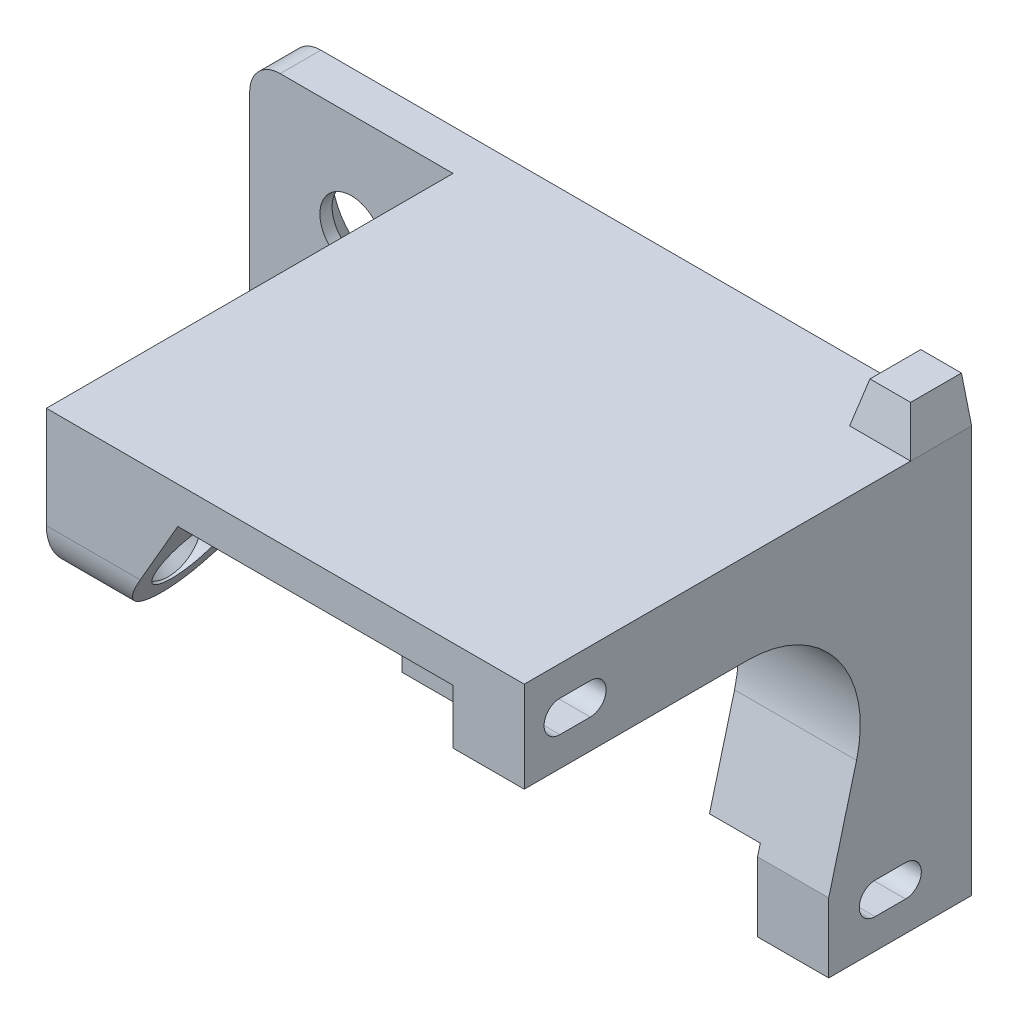
from build123d import *
from OCP.BRepFilletAPI import BRepFilletAPI_MakeChamfer

# Parameters (mm, degrees)
SKETCH1_R           = 3.1
BOSS_EXTRUDE1_DEPTH = 9
SKETCH2_W           = 20
SKETCH2_H           = 40
CUT_EXTRUDE1_DEPTH  = 5
SKETCH3_R           = 6.05
CUT_EXTRUDE2_DEPTH  = 5
BOSS_EXTRUDE2_DEPTH = 35
SKETCH5_W           = 7
SKETCH5_H           = 12
CUT_EXTRUDE3_DEPTH  = 6
CHAMFER1_SIZE       = 6
CHAMFER1_SIZE2      = 4
CHAMFER2_SIZE       = 1
CUT_EXTRUDE4_DEPTH  = 12
CUT_EXTRUDE5_START  = -7
CUT_EXTRUDE5_DEPTH  = 11
SKETCH8_W           = 6
SKETCH8_H           = 6
BOSS_EXTRUDE3_DEPTH = 4
CHAMFER5_SIZE       = 4
CHAMFER5_SIZE_2     = 1
CHAMFER6_SIZE       = 1
CHAMFER6_SIZE2      = 4
CHAMFER7_SIZE       = 2.8
BOSS_EXTRUDE4_DEPTH = 6
CHAMFER8_START      = 16
CHAMFER8_DEPTH      = 0.515103423
CHAMFER8_START_2    = 16.515103423
CHAMFER8_2_DEPTH    = 6.413099807
CHAMFER8_START_3    = 11.656406461
CHAMFER8_3_DEPTH    = 6.343593539
CUT_EXTRUDE6_REACH  = 70.71
SKETCH10_R          = 1.55
CUT_EXTRUDE7_REACH  = 77.71
CUT_EXTRUDE7_START  = -7
SKETCH11_R          = 3.35
CHAMFER9_SIZE       = 1.8


with BuildPart() as part:
    # Sketch1 → Boss-Extrude1 (new body)
    with BuildSketch(Plane.XY):
        with BuildLine():
            Line((-10, 17), (-10, -17))
            ThreePointArc((-10, -17), (-9.121320344, -19.121320344), (-7, -20))
            Line((-7, -20), (10, -20))
            Line((10, -20), (25, -20))
            Line((25, -20), (38, -2))
            Line((38, -2), (45, -2))
            Line((45, -2), (45, -20))
            Line((45, -20), (57, -20))
            Line((57, -20), (57, 20))
            Line((57, 20), (-7, 20))
            ThreePointArc((-7, 20), (-9.121320344, 19.121320344), (-10, 17))
        make_face()
        with Locations((0, 10)):
            Circle(SKETCH1_R, mode=Mode.SUBTRACT)
        with Locations((0, -10)):
            Circle(SKETCH1_R, mode=Mode.SUBTRACT)
    extrude(amount=BOSS_EXTRUDE1_DEPTH)

    # Sketch2 → Cut-Extrude1 (cut)
    with BuildSketch(Plane.XY.offset(9)):
        Rectangle(SKETCH2_W, SKETCH2_H)
    extrude(amount=-CUT_EXTRUDE1_DEPTH, mode=Mode.SUBTRACT)

    # Sketch3 → Cut-Extrude2 (cut)
    with BuildSketch(Plane.XY.offset(9)):
        with Locations((28, -8)):
            Circle(SKETCH3_R)
    extrude(amount=-CUT_EXTRUDE2_DEPTH, mode=Mode.SUBTRACT)

    # Sketch4 → Boss-Extrude2 (add)
    with BuildSketch(Plane.XY.offset(9)):
        Polygon((45, -20), (57, -20), (57, 20), (10, 20), (10, 16.4), (45, 16.4), align=None)
    extrude(amount=BOSS_EXTRUDE2_DEPTH)

    # Sketch5 → Cut-Extrude3 (cut)
    with BuildSketch(Plane.XY.offset(9)):
        with Locations((41.5, 4)):
            Rectangle(SKETCH5_W, SKETCH5_H)
    extrude(amount=-CUT_EXTRUDE3_DEPTH, mode=Mode.SUBTRACT)

    # Chamfer1
    chamfer1_edges = [part.edges().sort_by_distance(p)[0] for p in [
        (41.5, 10, 9),
    ]]
    chamfer1_side = [part.faces().sort_by_distance(p)[0] for p in [
        (23.115817962, 1.462286031, 9),
    ]]
    chamfer(chamfer1_edges, length=CHAMFER1_SIZE, length2=CHAMFER1_SIZE2, reference=chamfer1_side[0])

    # Chamfer2
    chamfer2_edges = [part.edges().sort_by_distance(p)[0] for p in [
        (41.5, -2, 3),
    ]]
    chamfer(chamfer2_edges, length=CHAMFER2_SIZE)

    # Sketch6 → Cut-Extrude4 (cut)
    with BuildSketch(Plane(origin=(57, 0, 0), x_dir=(0, 0, -1), z_dir=(1, 0, 0))):
        with BuildLine():
            Line((-22, 11.05), (-44, 11.05))
            Line((-44, 11.05), (-44, -20))
            Line((-44, -20), (-14.055648488, -20))
            Line((-14.055648488, -20), (-14.055648488, -13.173106135))
            Line((-14.055648488, -13.173106135), (-11.317710156, -2.826868177))
            ThreePointArc((-11.317710156, -2.826868177), (-13.243876618, 6.740385992), (-22, 11.05))
        make_face()
        with BuildLine():
            Line((-40.5, 17.05), (-37.5, 17.05))
            ThreePointArc((-37.5, 17.05), (-35.95, 15.5), (-37.5, 13.95))
            Line((-37.5, 13.95), (-40.5, 13.95))
            ThreePointArc((-40.5, 13.95), (-42.05, 15.5), (-40.5, 17.05))
        make_face()
        with BuildLine():
            Line((-9.5, -17.05), (-6.5, -17.05))
            ThreePointArc((-6.5, -17.05), (-4.95, -15.5), (-6.5, -13.95))
            Line((-6.5, -13.95), (-9.5, -13.95))
            ThreePointArc((-9.5, -13.95), (-11.05, -15.5), (-9.5, -17.05))
        make_face()
    extrude(amount=-CUT_EXTRUDE4_DEPTH, mode=Mode.SUBTRACT)

    # Sketch7 → Cut-Extrude5 (cut)
    with BuildSketch(Plane(origin=(57, 0, 0), x_dir=(0, 0, -1), z_dir=(1, 0, 0)).offset(CUT_EXTRUDE5_START)):
        with BuildLine():
            Line((-6.5, -18.85), (-6.5, -20))
            Line((-6.5, -20), (-14.055648488, -20))
            Line((-14.055648488, -20), (-14.055648488, -12.15))
            Line((-14.055648488, -12.15), (-6.5, -12.15))
            ThreePointArc((-6.5, -12.15), (-3.15, -15.5), (-6.5, -18.85))
        make_face()
        with BuildLine():
            Line((-37.5, 18.85), (-40.5, 18.85))
            ThreePointArc((-40.5, 18.85), (-42.009108789, 18.490834443), (-43.194623608, 17.490352635))
            Line((-43.194623608, 17.490352635), (-44, 16.4))
            Line((-44, 16.4), (-44, 11.05))
            Line((-44, 11.05), (-37.5, 11.05))
            Line((-37.5, 11.05), (-37.5, 12.15))
            ThreePointArc((-37.5, 12.15), (-34.15, 15.5), (-37.5, 18.85))
        make_face()
    extrude(amount=-CUT_EXTRUDE5_DEPTH, mode=Mode.SUBTRACT)

    # Sketch8 → Boss-Extrude3 (add)
    with BuildSketch(Plane(origin=(0, 20, 0), x_dir=(1, 0, 0), z_dir=(0, 1, 0))):
        with Locations((54, -3)):
            Rectangle(SKETCH8_W, SKETCH8_H)
    extrude(amount=BOSS_EXTRUDE3_DEPTH)

    # Chamfer5
    chamfer5_edges_1 = [part.edges().sort_by_distance(p)[0] for p in [
        (51, 24, 3),
    ]]
    chamfer5_side_1 = [part.faces().sort_by_distance(p)[0] for p in [
        (51, 23.98, 3),
    ]]
    chamfer5_edges_2 = [part.edges().sort_by_distance(p)[0] for p in [
        (54, 24, 6),
    ]]
    chamfer5_side_2 = [part.faces().sort_by_distance(p)[0] for p in [
        (54, 24, 5.98),
    ]]
    chamfer5_edges_3 = [part.edges().sort_by_distance(p)[0] for p in [
        (57, 24, 3),
    ]]
    chamfer5_side_3 = [part.faces().sort_by_distance(p)[0] for p in [
        (56.98, 24, 3),
    ]]
    chamfer5 = BRepFilletAPI_MakeChamfer(part.part.solid().wrapped)
    for e in chamfer5_edges_1:
        chamfer5.Add(CHAMFER5_SIZE - 0.0001, CHAMFER5_SIZE_2 - 0.0001, e.wrapped, chamfer5_side_1[0].wrapped)
    for e in chamfer5_edges_2:
        chamfer5.Add(CHAMFER5_SIZE_2 - 0.0001, CHAMFER5_SIZE - 0.0001, e.wrapped, chamfer5_side_2[0].wrapped)
    for e in chamfer5_edges_3:
        chamfer5.Add(CHAMFER5_SIZE_2 - 0.0001, CHAMFER5_SIZE - 0.0001, e.wrapped, chamfer5_side_3[0].wrapped)
    add(Compound.cast(chamfer5.Shape()), mode=Mode.REPLACE)  # a hair under: the kernel refuses the full size

    # Chamfer6
    chamfer6_edges = [part.edges().sort_by_distance(p)[0] for p in [
        (38, 7, 9),
    ]]
    chamfer6_side = [part.faces().sort_by_distance(p)[0] for p in [
        (22.148058049, 0.854930368, 9),
    ]]
    chamfer(chamfer6_edges, length=CHAMFER6_SIZE, length2=CHAMFER6_SIZE2, reference=chamfer6_side[0])

    # Chamfer7
    chamfer7_edges = [part.edges().sort_by_distance(p)[0] for p in [
        (-3.1, 10, 0),
        (-3.1, -10, 0),
    ]]
    chamfer(chamfer7_edges, length=CHAMFER7_SIZE)

    # Sketch9 → Boss-Extrude4 (add)
    with BuildSketch(Plane.ZY.offset(-10)):
        with BuildLine():
            Line((44, 16.4), (44, 10))
            ThreePointArc((44, 10), (40.913417162, 5.380602337), (35.464466094, 6.464466094))
            Line((35.464466094, 6.464466094), (25.528932188, 16.4))
            Line((25.528932188, 16.4), (44, 16.4))
        make_face()
    extrude(amount=-BOSS_EXTRUDE4_DEPTH)

    # Chamfer8: read off the stored shape, not the designer's step
    # Chamfer8 outline → Chamfer8 (add)
    with BuildSketch(Plane.YZ.offset(CHAMFER8_START)):
        with BuildLine():
            ThreePointArc((10, 44), (5.380602337, 40.913417162), (6.464466094, 35.464466094))
            Line((6.464466094, 35.464466094), (16.4, 25.528932188))
            Line((16.4, 25.528932188), (16.4, 44))
            Line((16.4, 44), (10, 44))
        make_face()
    extrude(amount=CHAMFER8_DEPTH)

    # Chamfer8 2 outline → Chamfer8 2 (add)
    with BuildSketch(Plane.YZ.offset(CHAMFER8_START_2)):
        with BuildLine():
            ThreePointArc((10, 44), (5.380602337, 40.913417162), (6.464466094, 35.464466094))
            Line((6.464466094, 35.464466094), (16.4, 25.528932188))
            Line((16.4, 25.528932188), (16.4, 44))
            Line((16.4, 44), (10, 44))
        make_face()
    extrude(amount=CHAMFER8_2_DEPTH)

    # Chamfer8 3 outline → Chamfer8 3 (cut)
    with BuildSketch(Plane(origin=(0, 0, 0), x_dir=(0.500000000000006, 0.8660254037844353, 0), z_dir=(0.8660254037844352, -0.5000000000000061, 0)).offset(CHAMFER8_START_3)):
        with BuildLine():
            add(Edge.make_bspline(
                [(14.194351887, 35.464466094), (4.33836629, 44), (18.276834792, 44)],
                knots=[5.497787144, 5.497787144, 5.497787144, 7.853981634, 7.853981634, 7.853981634], degree=2, weights=[1, 0.382683432, 1]))
            Line((14.194351887, 35.464466094), (25.666918237, 25.528932188))
            Line((25.666918237, 25.528932188), (25.666918237, 44))
            Line((25.666918237, 44), (18.276834792, 44))
        make_face()
    extrude(amount=CHAMFER8_3_DEPTH, mode=Mode.SUBTRACT)

    # Cut-Extrude6: up to this plane
    cut_extrude6_end = Plane(origin=(22.92820323, 16.4, 44), z_dir=(-0.8660254037844355, 0.5000000000000057, 0))
    # Sketch10 → Cut-Extrude6 (cut, up to the surface)
    with BuildSketch(Plane.ZY.offset(-10), mode=Mode.PRIVATE) as cut_extrude6_sk1:
        with Locations(Location((39, 10, 0), (0, 0, 270))):
            Circle(SKETCH10_R)
    cut_extrude6_tool1 = split(extrude(cut_extrude6_sk1.sketch, amount=-CUT_EXTRUDE6_REACH, mode=Mode.PRIVATE), bisect_by=cut_extrude6_end, keep=Keep.BOTH, mode=Mode.PRIVATE)
    add(cut_extrude6_tool1.solids().sort_by_distance((10, 10, 39))[0], mode=Mode.SUBTRACT)

    # Sketch11 → Cut-Extrude7 (cut, up to next)
    with BuildSketch(Plane.ZY.offset(-10).offset(CUT_EXTRUDE7_START), mode=Mode.PRIVATE) as cut_extrude7_sk1:
        with Locations(Location((39, 10, 0), (0, 0, 270))):
            Circle(SKETCH11_R)
    cut_extrude7_tool1 = extrude(cut_extrude7_sk1.sketch, amount=-CUT_EXTRUDE7_REACH, mode=Mode.PRIVATE) & part.part
    add(cut_extrude7_tool1.solids().sort_by_distance((17, 10, 39))[0], mode=Mode.SUBTRACT)

    # Chamfer9
    chamfer9_edges = [part.edges().sort_by_distance(p)[0] for p in [
        (17, 11.55, 39),
    ]]
    chamfer(chamfer9_edges, length=CHAMFER9_SIZE - 0.0001)  # a hair under: the kernel refuses the full size


solid = part.part
